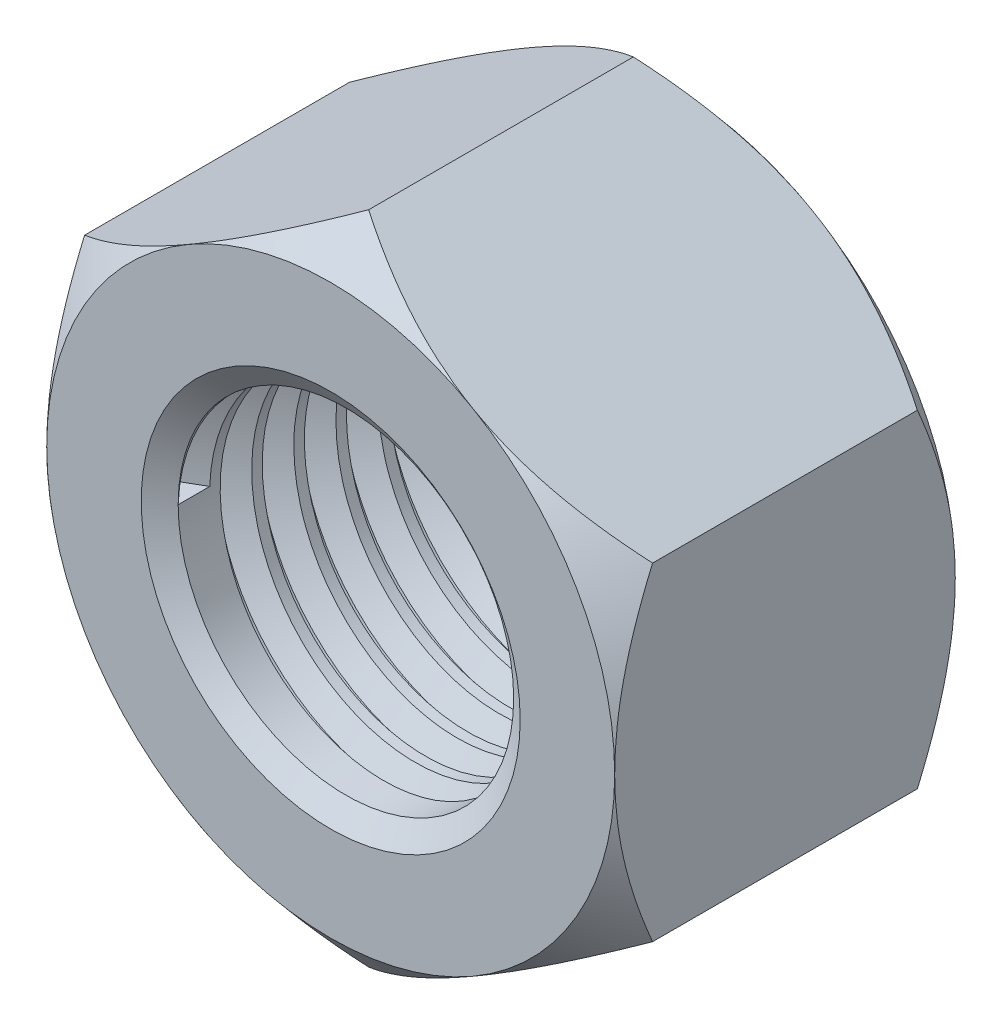
from build123d import *

# Parameters (mm, degrees)
BASENUTSKE_R  = 4.2164
BASENUT_DEPTH = 8.5598
THREAD1_PITCH = 1.058333333


with BuildPart() as part:
    # BaseNutSke → BaseNut (new body)
    with BuildSketch(Plane.XY):
        Polygon((7.1374, 4.120779811), (7.1374, -4.120779811), (0, -8.241559623), (-7.1374, -4.120779811), (-7.1374, 4.120779811), (0, 8.241559623), align=None)
        Circle(BASENUTSKE_R, mode=Mode.SUBTRACT)
    extrude(amount=-BASENUT_DEPTH)

    # Sketch3 → Double-Chamfer (revolve, cut)
    with BuildSketch(Plane(origin=(0, 0, 0), x_dir=(0, 0, -1), z_dir=(1, 0, 0))):
        Polygon((8.5598, 7.1374), (7.6073, 8.241559623), (7.6073, 20.941559623), (21.2598, 20.941559623), (21.2598, 7.1374), align=None)
        Polygon((0.9525, 20.941559623), (-12.7, 20.941559623), (-12.7, 7.1374), (0, 7.1374), (0.9525, 8.241559623), align=None)
    revolve(axis=Axis((0, 0, 0), (0, 0, -1)), mode=Mode.SUBTRACT)

    # Sketch5 → EndChamfer (revolve, cut)
    with BuildSketch(Plane(origin=(0, 0, 0), x_dir=(0, 0, -1), z_dir=(1, 0, 0)), mode=Mode.PRIVATE) as endchamfer_sk:
        Polygon((8.5344, 4.7625), (8.11377833, 4.16179), (8.5852, 4.16179), (8.5852, 4.7625), align=None)
        Polygon((-0.0508, 4.7625), (0, 4.7625), (0.42062167, 4.16179), (-0.0508, 4.16179), align=None)
    revolve(endchamfer_sk.sketch.rotate(Axis((0, 0, -25.037505729), (0, 0, -1)), 90), axis=Axis((0, 0, -25.037505729), (0, 0, -1)), mode=Mode.SUBTRACT)

    # Thread1: the profile of Thread Profile1 profile screwed along a right-hand helix of 7.341386 turns, 8 arcs to a turn; built about Z, then put on its axis
    thread1_z = Axis((0, 0, 0), (0, 0, 1))
    thread1_corners = [(4.2161, 0, -0.000173205), (4.789239718, 0, 0.330729165), (4.789239718, 0, 0.463020832), (4.2161, 0, 0.793923202)]
    with BuildLine(mode=Mode.PRIVATE) as thread1_profile:
        Line(thread1_corners[0], thread1_corners[1])
        Line(thread1_corners[1], thread1_corners[2])
        Line(thread1_corners[2], thread1_corners[3])
        Line(thread1_corners[3], thread1_corners[0])
    thread1_cap = Face(thread1_profile.wire())
    thread1_turn_angles = [0, 22.5, 45, 67.5, 90, 112.5, 135, 157.5, 180, 202.5, 225, 247.5, 270, 292.5, 315, 337.5, 360]
    thread1_turn_weights = [1, 0.9238795325112867, 1, 0.9238795325112867, 1, 0.9238795325112867, 1, 0.9238795325112867, 1, 0.9238795325112867, 1, 0.9238795325112867, 1, 0.9238795325112867, 1, 0.9238795325112867, 1]
    thread1_turn_rails = [Edge.make_bspline([Vector(p[0], p[1], 0).rotate(thread1_z, thread1_turn_angles[k]) / thread1_turn_weights[k] + Vector(0, 0, p[2] + THREAD1_PITCH * thread1_turn_angles[k] / 360) for k in range(17)], [0, 0, 0, 1, 1, 2, 2, 3, 3, 4, 4, 5, 5, 6, 6, 7, 7, 8, 8, 8], 2, thread1_turn_weights) for p in thread1_corners]
    thread1_turn_sides = [Face.make_surface_from_curves(thread1_turn_rails[p[0]], thread1_turn_rails[p[1]]) for p in [(0, 1), (1, 2), (2, 3), (3, 0)]]
    thread1_last_angles = [2520, 2542.5, 2565, 2587.5, 2610, 2626.449447702, 2642.898895404]
    thread1_last_weights = [1, 0.9238795325112867, 1, 0.9238795325112867, 1, 0.9590699495206253, 1]
    thread1_last_rails = [Edge.make_bspline([Vector(p[0], p[1], 0).rotate(thread1_z, thread1_last_angles[k]) / thread1_last_weights[k] + Vector(0, 0, p[2] + THREAD1_PITCH * thread1_last_angles[k] / 360) for k in range(7)], [0, 0, 0, 1, 1, 2, 2, 3, 3, 3], 2, thread1_last_weights) for p in thread1_corners]
    thread1_last_sides = [Face.make_surface_from_curves(thread1_last_rails[p[0]], thread1_last_rails[p[1]]) for p in [(0, 1), (1, 2), (2, 3), (3, 0)]]
    thread1 = Plane(origin=(0, 0, -0.382383337), x_dir=(-1, 0, 0), z_dir=(0, 0, -1)) * Solid(Shell([*[p.moved(Location((0, 0, THREAD1_PITCH * i))) for i in range(7) for p in thread1_turn_sides], *thread1_last_sides, thread1_cap, thread1_cap.rotate(thread1_z, 2642.898895404).moved(Location((0, 0, THREAD1_PITCH * 2642.898895404 / 360)))]))
    add(thread1, mode=Mode.SUBTRACT)


solid = part.part
